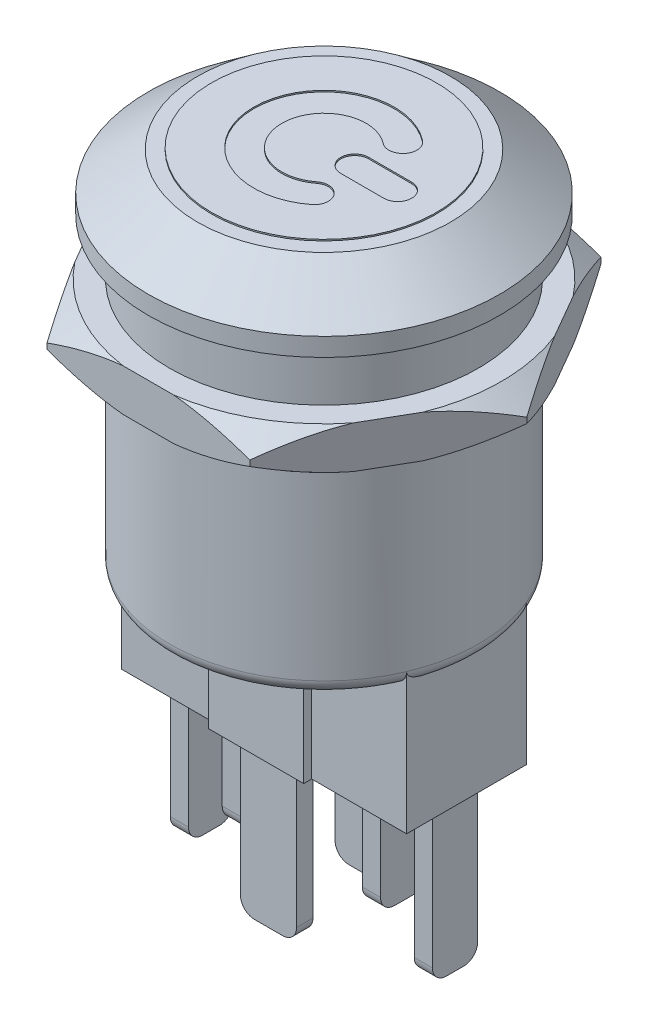
from build123d import *

# Parameters (mm, degrees)
SKETCH_1_R          = 11
EXTRUDE_1_DEPTH     = 15
EXTRUDE_5_DEPTH     = 9
EXTRUDE_START       = 9
SKETCH_2_W          = 1.293526219
SKETCH_2_H          = 3.220572058
SKETCH_2_W_2        = 1.29352622
SKETCH_2_W_3        = 3.99471459
SKETCH_2_H_2        = 1.168280376
EXTRUDE_2_DEPTH     = 11
EXTRUDE_6_DEPTH     = 3
SKETCH_10_R         = 12.5
EXTRUDE_7_DEPTH     = 8
CHAMFER_2_SIZE      = 2.7
CHAMFER_2_SIZE2     = 3.5
FILLET_2_R          = 1
FILLET_3_R          = 1
SKETCH_13_R         = 8
EXTRUDE_8_DEPTH     = 0.1
CUT_EXTRUDE_3_DEPTH = 0.1
FILLET_4_R          = 1
FILLET_5_R          = 1
SKETCH_15_R         = 12.5
SKETCH_15_R_2       = 11
CUT_EXTRUDE_4_DEPTH = 4
CUT_EXTRUDE_5_DEPTH = 0.1
SKETCH_17_W         = 1.293526219
SKETCH_17_H         = 2.5
CUT_EXTRUDE_6_DEPTH = 33.994598121
FILLET_6_R          = 1


# Some blends are built 0.0001 mm under size
with BuildPart() as part:
    # 草图1 → 凸台-拉伸1 (new body)
    with BuildSketch(Plane(origin=(0, 0, 0), x_dir=(1, 0, 0), z_dir=(0, 1, 0))):
        with Locations(Location((0, 0, 0), (0, 0, 270))):
            Circle(SKETCH_1_R)
    extrude(amount=EXTRUDE_1_DEPTH)

    # 草图8 → 凸台-拉伸5 (add)
    with BuildSketch(Plane.XZ):
        Polygon((-3.382547232, 4.259557328), (-3.382547232, 4.825560501), (3.382547232, 4.825560501), (3.382547232, 4.259557328), (10.141803162, 4.259557328), (10.141803162, -4.259557328), (3.382547232, -4.259557328), (3.382547232, -4.825560501), (-3.382547232, -4.825560501), (-3.382547232, -4.259557328), (-10.141803162, -4.259557328), (-10.141803162, 4.259557328), align=None)
    extrude(amount=EXTRUDE_5_DEPTH)

    # 草图2 → 凸台-拉伸2 (add)
    with BuildSketch(Plane.XZ.offset(EXTRUDE_START)):
        with Locations((-4.988450059, 0)):
            Rectangle(SKETCH_2_W, SKETCH_2_H)
        with Locations((4.988450059, 0)):
            Rectangle(SKETCH_2_W, SKETCH_2_H)
        with Locations((8.683189087, 0)):
            Rectangle(SKETCH_2_W_2, SKETCH_2_H)
        with Locations((-8.683189087, 0)):
            Rectangle(SKETCH_2_W_2, SKETCH_2_H)
        with Locations((0, -3.368236223)):
            Rectangle(SKETCH_2_W_3, SKETCH_2_H_2)
        with Locations((0, 3.368236223)):
            Rectangle(SKETCH_2_W_3, SKETCH_2_H_2)
    extrude(amount=EXTRUDE_2_DEPTH)

    # 草图9 → 凸台-拉伸6 (add)
    with BuildSketch(Plane(origin=(0, 15, 0), x_dir=(1, 0, 0), z_dir=(0, 1, 0))):
        Polygon((-7.216878365, 12.5), (-14.43375673, 0), (-7.216878365, -12.5), (7.216878365, -12.5), (14.43375673, 0), (7.216878365, 12.5), align=None)
    extrude(amount=EXTRUDE_6_DEPTH)

    # 草图10 → 凸台-拉伸7 (add)
    with BuildSketch(Plane(origin=(0, 18, 0), x_dir=(1, 0, 0), z_dir=(0, 1, 0))):
        with Locations(Location((0, 0, 0), (0, 0, 270))):
            Circle(SKETCH_10_R)
    extrude(amount=EXTRUDE_7_DEPTH)

    # 倒角2
    chamfer_2_edges = [part.edges().sort_by_distance(p)[0] for p in [
        (0, 26, -12.5),
    ]]
    chamfer_2_side = [part.faces().sort_by_distance(p)[0] for p in [
        (0, 22, -12.5),
    ]]
    chamfer(chamfer_2_edges, length=CHAMFER_2_SIZE, length2=CHAMFER_2_SIZE2, reference=chamfer_2_side[0])

    # 草图12 → 切除-旋转1 (revolve, cut)
    with BuildSketch(Plane.XY, mode=Mode.PRIVATE) as cut_revolve_1_sk:
        Polygon((-12.629537139, 18), (-14.43375673, 16.7), (-14.43375673, 16.3), (-12.629537139, 15), (-12.629537139, 14.5), (-14.93375673, 14.5), (-14.93375673, 18.5), (-12.629537139, 18.5), align=None)
    revolve(cut_revolve_1_sk.sketch.rotate(Axis((0, 15, 0), (0, 1, 0)), 202.78240573), axis=Axis((0, 15, 0), (0, 1, 0)), mode=Mode.SUBTRACT)

    # 圆角2
    # the kernel refuses this fillet: 1 mm, written as the material it takes off along each edge
    with BuildSketch(Plane(origin=(0, 0, 0), x_dir=(0.9219821056073602, 0, -0.3872324843550948), z_dir=(0.3872324843550948, 0, 0.9219821056073602))) as fillet_2_piece_1_section:
        with BuildLine():
            CenterArc((11 - FILLET_2_R, FILLET_2_R), FILLET_2_R, 270, 90)
            Line((11 - FILLET_2_R, 0), (11, 0))
            Line((11, 0), (11, FILLET_2_R))
        make_face()
    fillet_2_piece_1 = revolve(axis=Axis((0, 0, 0), (0, 1, 0)), revolution_arc=134.435188539, mode=Mode.PRIVATE)
    fillet_2_piece_1 = split(fillet_2_piece_1, bisect_by=Plane(origin=(0, 0.280498427, -4.259557328), z_dir=(0, 0, -1)), keep=Keep.TOP, mode=Mode.PRIVATE)
    add(fillet_2_piece_1, mode=Mode.SUBTRACT)
    with BuildSketch(Plane(origin=(0, 0, 0), x_dir=(0, 0, 1), z_dir=(-1, 0, 0))) as fillet_2_piece_2_section:
        with BuildLine():
            CenterArc((11 - FILLET_2_R, FILLET_2_R), FILLET_2_R, 270, 90)
            Line((11 - FILLET_2_R, 0), (11, 0))
            Line((11, 0), (11, FILLET_2_R))
        make_face()
    fillet_2_piece_2 = revolve(axis=Axis((0, 0, 0), (0, 1, 0)), revolution_arc=67.21759427, mode=Mode.PRIVATE)
    fillet_2_piece_2 = split(fillet_2_piece_2, bisect_by=Plane(origin=(5.932037011, 0.283055472, 4.259557328), z_dir=(0, 0, 1)), keep=Keep.TOP, mode=Mode.PRIVATE)
    add(fillet_2_piece_2, mode=Mode.SUBTRACT)
    with BuildSketch(Plane(origin=(0, 0, 0), x_dir=(-0.9219821056073602, 0, 0.38723248435509466), z_dir=(-0.38723248435509466, 0, -0.9219821056073602))) as fillet_2_piece_3_section:
        with BuildLine():
            CenterArc((11 - FILLET_2_R, FILLET_2_R), FILLET_2_R, 270, 90)
            Line((11 - FILLET_2_R, 0), (11, 0))
            Line((11, 0), (11, FILLET_2_R))
        make_face()
    fillet_2_piece_3 = revolve(axis=Axis((0, 0, 0), (0, 1, 0)), revolution_arc=67.21759427, mode=Mode.PRIVATE)
    fillet_2_piece_3 = split(fillet_2_piece_3, bisect_by=Plane(origin=(-5.93203701, 0.283055475, 4.259557328), z_dir=(0, 0, 1)), keep=Keep.TOP, mode=Mode.PRIVATE)
    add(fillet_2_piece_3, mode=Mode.SUBTRACT)

    # 圆角3
    # the kernel refuses this fillet: 1 mm, written as the material it takes off along each edge
    with BuildSketch(Plane(origin=(0, 0, 0), x_dir=(0.811007517406604, 0, 0.5850357311395405), z_dir=(-0.5850357311395405, 0, 0.811007517406604))) as fillet_3_piece_1_section:
        with BuildLine():
            CenterArc((11 - FILLET_3_R, FILLET_3_R), FILLET_3_R, 270, 90)
            Line((11 - FILLET_3_R, 0), (11, 0))
            Line((11, 0), (11, FILLET_3_R))
        make_face()
    fillet_3_piece_1 = revolve(axis=Axis((0, 0, 0), (0, 1, 0)), revolution_arc=71.611028585, mode=Mode.PRIVATE)
    fillet_3_piece_1 = split(fillet_3_piece_1, bisect_by=Plane(origin=(9.365381882, 0.233729185, 4.259557328), z_dir=(0, 0, 1)), keep=Keep.TOP, mode=Mode.PRIVATE)
    fillet_3_piece_1 = split(fillet_3_piece_1, bisect_by=Plane(origin=(10.141803162, 0.233729185, 5.307217675), z_dir=(-1, 0, 0)), keep=Keep.TOP, mode=Mode.PRIVATE)
    add(fillet_3_piece_1, mode=Mode.SUBTRACT)
    with BuildSketch(Plane(origin=(0, 0, 0), x_dir=(0.811007517406604, 0, 0.5850357311395405), z_dir=(-0.5850357311395405, 0, 0.811007517406604))) as fillet_3_piece_2_section:
        with BuildLine():
            CenterArc((11 - FILLET_3_R, FILLET_3_R), FILLET_3_R, 270, 90)
            Line((11 - FILLET_3_R, 0), (11, 0))
            Line((11, 0), (11, FILLET_3_R))
        make_face()
    fillet_3_piece_2 = revolve(axis=Axis((0, 0, 0), (0, 1, 0)), revolution_arc=71.611028585, mode=Mode.PRIVATE)
    fillet_3_piece_2 = split(fillet_3_piece_2, bisect_by=Plane(origin=(9.365382131, 0.233729175, -4.259557328), z_dir=(0, 0, -1)), keep=Keep.TOP, mode=Mode.PRIVATE)
    fillet_3_piece_2 = split(fillet_3_piece_2, bisect_by=Plane(origin=(10.141803162, 0.233729175, -5.307217523), z_dir=(-1, 0, 0)), keep=Keep.TOP, mode=Mode.PRIVATE)
    add(fillet_3_piece_2, mode=Mode.SUBTRACT)
    with BuildSketch(Plane(origin=(0, 0, 0), x_dir=(0.811007517406604, 0, 0.5850357311395405), z_dir=(-0.5850357311395405, 0, 0.811007517406604))) as fillet_3_piece_3_section:
        with BuildLine():
            CenterArc((11 - FILLET_3_R, FILLET_3_R), FILLET_3_R, 270, 90)
            Line((11 - FILLET_3_R, 0), (11, 0))
            Line((11, 0), (11, FILLET_3_R))
        make_face()
    fillet_3_piece_3 = revolve(axis=Axis((0, 0, 0), (0, 1, 0)), revolution_arc=71.611028585, mode=Mode.PRIVATE)
    fillet_3_piece_3 = split(fillet_3_piece_3, bisect_by=Plane(origin=(10.764842796, 0.336885819, 4.259557328), z_dir=(0, 0, -1)), keep=Keep.TOP, mode=Mode.PRIVATE)
    fillet_3_piece_3 = split(fillet_3_piece_3, bisect_by=Plane(origin=(10.764842796, 0.336885819, -4.259557328), z_dir=(0, 0, 1)), keep=Keep.TOP, mode=Mode.PRIVATE)
    fillet_3_piece_3 = split(fillet_3_piece_3, bisect_by=Plane(origin=(10.141803162, 0.336885819, 0), z_dir=(1, 0, 0)), keep=Keep.TOP, mode=Mode.PRIVATE)
    add(fillet_3_piece_3, mode=Mode.SUBTRACT)
    with BuildSketch(Plane(origin=(0, 0, 0), x_dir=(-0.8110075174066043, 0, -0.5850357311395403), z_dir=(0.5850357311395403, 0, -0.8110075174066043))) as fillet_3_piece_4_section:
        with BuildLine():
            CenterArc((11 - FILLET_3_R, FILLET_3_R), FILLET_3_R, 270, 90)
            Line((11 - FILLET_3_R, 0), (11, 0))
            Line((11, 0), (11, FILLET_3_R))
        make_face()
    fillet_3_piece_4 = revolve(axis=Axis((0, 0, 0), (0, 1, 0)), revolution_arc=71.611028585, mode=Mode.PRIVATE)
    fillet_3_piece_4 = split(fillet_3_piece_4, bisect_by=Plane(origin=(-9.365381882, 0.233729185, -4.259557328), z_dir=(0, 0, -1)), keep=Keep.TOP, mode=Mode.PRIVATE)
    fillet_3_piece_4 = split(fillet_3_piece_4, bisect_by=Plane(origin=(-10.141803162, 0.233729185, -5.307217675), z_dir=(1, 0, 0)), keep=Keep.TOP, mode=Mode.PRIVATE)
    add(fillet_3_piece_4, mode=Mode.SUBTRACT)
    with BuildSketch(Plane(origin=(0, 0, 0), x_dir=(-0.8110075174066043, 0, -0.5850357311395403), z_dir=(0.5850357311395403, 0, -0.8110075174066043))) as fillet_3_piece_5_section:
        with BuildLine():
            CenterArc((11 - FILLET_3_R, FILLET_3_R), FILLET_3_R, 270, 90)
            Line((11 - FILLET_3_R, 0), (11, 0))
            Line((11, 0), (11, FILLET_3_R))
        make_face()
    fillet_3_piece_5 = revolve(axis=Axis((0, 0, 0), (0, 1, 0)), revolution_arc=71.611028585, mode=Mode.PRIVATE)
    fillet_3_piece_5 = split(fillet_3_piece_5, bisect_by=Plane(origin=(-9.365382131, 0.233729175, 4.259557328), z_dir=(0, 0, 1)), keep=Keep.TOP, mode=Mode.PRIVATE)
    fillet_3_piece_5 = split(fillet_3_piece_5, bisect_by=Plane(origin=(-10.141803162, 0.233729175, 5.307217523), z_dir=(1, 0, 0)), keep=Keep.TOP, mode=Mode.PRIVATE)
    add(fillet_3_piece_5, mode=Mode.SUBTRACT)
    with BuildSketch(Plane(origin=(0, 0, 0), x_dir=(-0.8110075174066043, 0, -0.5850357311395403), z_dir=(0.5850357311395403, 0, -0.8110075174066043))) as fillet_3_piece_6_section:
        with BuildLine():
            CenterArc((11 - FILLET_3_R, FILLET_3_R), FILLET_3_R, 270, 90)
            Line((11 - FILLET_3_R, 0), (11, 0))
            Line((11, 0), (11, FILLET_3_R))
        make_face()
    fillet_3_piece_6 = revolve(axis=Axis((0, 0, 0), (0, 1, 0)), revolution_arc=71.611028585, mode=Mode.PRIVATE)
    fillet_3_piece_6 = split(fillet_3_piece_6, bisect_by=Plane(origin=(-10.764842796, 0.336885819, 4.259557328), z_dir=(0, 0, -1)), keep=Keep.TOP, mode=Mode.PRIVATE)
    fillet_3_piece_6 = split(fillet_3_piece_6, bisect_by=Plane(origin=(-10.764842796, 0.336885819, -4.259557328), z_dir=(0, 0, 1)), keep=Keep.TOP, mode=Mode.PRIVATE)
    fillet_3_piece_6 = split(fillet_3_piece_6, bisect_by=Plane(origin=(-10.141803162, 0.336885819, 0), z_dir=(-1, 0, 0)), keep=Keep.TOP, mode=Mode.PRIVATE)
    add(fillet_3_piece_6, mode=Mode.SUBTRACT)

    # 草图13 → 凸台-拉伸8 (add)
    with BuildSketch(Plane(origin=(0, 26, 0), x_dir=(1, 0, 0), z_dir=(0, 1, 0))):
        with Locations(Location((0, 0, 0), (0, 0, 270))):
            Circle(SKETCH_13_R)
    extrude(amount=EXTRUDE_8_DEPTH)

    # 草图14 → 切除-拉伸3 (cut)
    with BuildSketch(Plane(origin=(0, 26.1, 0), x_dir=(1, 0, 0), z_dir=(0, 1, 0))):
        with BuildLine():
            Line((5.250174633, -0.993620884), (2.189878709, -0.993620884))
            ThreePointArc((2.189878709, -0.993620884), (1.196257825, 0), (2.189878709, 0.993620884))
            Line((2.189878709, 0.993620884), (5.250174633, 0.993620884))
            ThreePointArc((5.250174633, 0.993620884), (6.243795517, 0), (5.250174633, -0.993620884))
        make_face()
        with BuildLine():
            Line((2.380060021, 1.826284287), (3.966766701, 3.043807145))
            ThreePointArc((3.966766701, 3.043807145), (-5, 0), (3.966766701, -3.043807145))
            Line((3.966766701, -3.043807145), (2.380060021, -1.826284287))
            ThreePointArc((2.380060021, -1.826284287), (-3, 0), (2.380060021, 1.826284287))
        make_face()
    extrude(amount=-CUT_EXTRUDE_3_DEPTH, mode=Mode.SUBTRACT)

    # 圆角4
    fillet_4_edges = [part.edges().sort_by_distance(p)[0] for p in [
        (2.380060021, 26.05, 1.826284287),
        (3.966766701, 26.05, 3.043807145),
        (2.380060021, 26.05, -1.826284287),
        (3.966766701, 26.05, -3.043807145),
    ]]
    fillet(fillet_4_edges, radius=FILLET_4_R - 0.0001)  # a hair under: the kernel refuses the full size

    # 圆角5
    fillet_5_edges = [part.edges().sort_by_distance(p)[0] for p in [
        (4.98845006, -20, 1.610286029),
        (4.98845006, -20, -1.610286029),
        (-4.98845006, -20, 1.610286029),
        (-4.98845006, -20, -1.610286029),
        (8.683189087, -20, 1.610286029),
        (8.683189087, -20, -1.610286029),
        (-8.683189087, -20, 1.610286029),
        (-8.683189087, -20, -1.610286029),
        (-1.997357295, -20, 3.368236223),
        (1.997357295, -20, 3.368236223),
        (-1.997357295, -20, -3.368236223),
        (1.997357295, -20, -3.368236223),
    ]]
    fillet(fillet_5_edges, radius=FILLET_5_R)

    # 草图15 → 切除-拉伸4 (cut)
    with BuildSketch(Plane(origin=(0, 18, 0), x_dir=(1, 0, 0), z_dir=(0, 1, 0))):
        with Locations(Location((0, 0, 0), (0, 0, 270))):
            Circle(SKETCH_15_R)
        with Locations(Location((0, 0, 0), (0, 0, 22.78240573))):
            Circle(SKETCH_15_R_2, mode=Mode.SUBTRACT)
    extrude(amount=CUT_EXTRUDE_4_DEPTH, mode=Mode.SUBTRACT)

    # 草图16 → 切除-拉伸5 (cut)
    # profile 1 of 3: a face of its own
    with BuildSketch(Plane(origin=(0, 0, -3.952376411), x_dir=(-1, 0, 0), z_dir=(0, 0, -1))):
        with BuildLine():
            Line((-1.632410444, -17.014702749), (-1.672683191, -16.979650543))
            Line((-1.672683191, -16.979650543), (-1.395994506, -16.758150437))
            add(Edge.make_bspline(
                [(-1.395994506, -16.758150437), (-1.384032445, -16.764552216), (-1.360405032, -16.777196984), (-1.324004489, -16.798095315), (-1.278445788, -16.814478473), (-1.221142501, -16.825076067), (-1.152810777, -16.832568507), (-1.103916702, -16.833163503), (-1.078287282, -16.833475389)],
                knots=[0, 0, 0, 0, 0.736410598, 1.454555069, 2.274010016, 3.348139226, 4.609940921, 6, 6, 6, 6], degree=3))
            Line((-1.078287282, -16.833475389), (1.48872742, -16.833475389))
            add(Edge.make_bspline(
                [(1.48872742, -16.833475389), (1.488900935, -16.812839266), (1.489218757, -16.775040607), (1.487301133, -16.724338256), (1.486186924, -16.684780124), (1.483774141, -16.652414865), (1.478864906, -16.617990797), (1.474454223, -16.573082278), (1.465458181, -16.513548394), (1.455817348, -16.443938946), (1.446382649, -16.373222272), (1.436692776, -16.31160858), (1.42838672, -16.263612324), (1.420351829, -16.218687015), (1.406228234, -16.173788752), (1.376704155, -16.135579285), (1.348040589, -16.110346225), (1.340700151, -16.090901979), (1.338077516, -16.083954826)],
                knots=[0, 0, 0, 0, 1.27150406, 2.328981501, 3.126175441, 3.710121142, 4.327662917, 5.268274525, 6.49017685, 8.03704954, 9.599095043, 10.886100789, 11.880913806, 12.598963807, 13.703656117, 14.733133062, 15.547366409, 16, 16, 16, 16], degree=3))
            add(Edge.make_bspline(
                [(1.338077516, -16.083954826), (1.340835635, -16.08074225), (1.348551492, -16.071755042), (1.36360783, -16.051917319), (1.389953093, -16.021298701), (1.426406057, -15.983125506), (1.462510373, -15.944270639), (1.491113826, -15.913275367), (1.511539107, -15.891070277), (1.532889947, -15.882271214), (1.550028312, -15.878982209), (1.560068688, -15.87782836), (1.564052372, -15.877370552)],
                knots=[0, 0, 0, 0, 0.405362904, 1.134005909, 2.383645024, 4.270006098, 6.190009657, 7.453402544, 8.329302161, 9.032620798, 9.616176397, 10, 10, 10, 10], degree=3))
            add(Edge.make_bspline(
                [(1.564052372, -15.877370552), (1.568833653, -15.879456074), (1.578446692, -15.883649136), (1.588003755, -15.898318223), (1.591766002, -15.917678469), (1.591597985, -15.950721012), (1.591240749, -15.998359781), (1.598828606, -16.060325874), (1.610143189, -16.126333111), (1.61685103, -16.179186482), (1.622766247, -16.219126241), (1.625357825, -16.248289772), (1.629237441, -16.285063524), (1.63382012, -16.329531353), (1.638017965, -16.381784621), (1.643334528, -16.441687794), (1.649439042, -16.509274062), (1.653109038, -16.557030396), (1.655038948, -16.582143618)],
                knots=[0, 0, 0, 0, 0.341458338, 0.686521615, 1.112861068, 1.643765959, 2.887577717, 4.288495481, 5.798885704, 7.356069376, 7.841520158, 8.491637465, 9.308408245, 10.308331643, 11.473375756, 12.805059145, 14.319903331, 16, 16, 16, 16], degree=3))
            Line((1.655038948, -16.582143618), (1.675175322, -16.793202642))
            Line((1.675175322, -16.793202642), (1.684870612, -16.909546133))
            add(Edge.make_bspline(
                [(1.684870612, -16.909546133), (1.689308032, -16.921681109), (1.69650833, -16.941371706), (1.69091194, -16.970120056), (1.674236221, -16.98303427), (1.655570308, -16.992254058), (1.626853375, -16.991882494), (1.587250144, -16.986466051), (1.53258125, -16.979371996), (1.491473455, -16.976197221), (1.468591047, -16.974430002)],
                knots=[0, 0, 0, 0, 1.061890483, 1.723057128, 2.249565985, 2.748629047, 3.431374921, 4.573939267, 6.092903808, 8, 8, 8, 8], degree=3))
            Line((1.468591047, -16.974430002), (1.171765989, -16.964734711))
            Line((1.171765989, -16.964734711), (-1.093948906, -16.964734711))
            add(Edge.make_bspline(
                [(-1.093948906, -16.964734711), (-1.122041433, -16.964628518), (-1.172509919, -16.964437741), (-1.239623462, -16.965551577), (-1.289616628, -16.965734301), (-1.334107535, -16.967984922), (-1.381109556, -16.970750903), (-1.439458023, -16.974800971), (-1.507739942, -16.984162494), (-1.555491999, -16.997621589), (-1.581696615, -17.005007458)],
                knots=[0, 0, 0, 0, 1.372320021, 2.465385735, 3.279152833, 3.814059266, 4.641307686, 5.579263069, 6.671586417, 8, 8, 8, 8], degree=3))
            Line((-1.581696615, -17.005007458), (-1.632410444, -17.014702749))
        make_face()
    # profile 2 of 3: a face of its own
    with BuildSketch(Plane(origin=(0, 0, -3.952376411), x_dir=(-1, 0, 0), z_dir=(0, 0, -1))):
        with BuildLine():
            Line((-1.18418969, -15.238227147), (-0.076689157, -15.238227147))
            Line((-0.076689157, -15.238227147), (-0.131877736, -14.815363307))
            add(Edge.make_bspline(
                [(-0.131877736, -14.815363307), (-0.133935728, -14.800168087), (-0.138513794, -14.766365863), (-0.149763204, -14.714562621), (-0.161304929, -14.662446521), (-0.173965498, -14.615791537), (-0.188267858, -14.57576116), (-0.201850674, -14.539243233), (-0.217695514, -14.506297429), (-0.231304685, -14.487303238), (-0.237780144, -14.478265502)],
                knots=[0, 0, 0, 0, 1.03230253, 2.296388048, 3.56754914, 4.627713308, 5.548966214, 6.428824589, 7.25240995, 8, 8, 8, 8], degree=3))
            Line((-0.237780144, -14.478265502), (-0.263137059, -14.432772214))
            Line((-0.263137059, -14.432772214), (-0.116961904, -14.286597059))
            add(Edge.make_bspline(
                [(-0.116961904, -14.286597059), (-0.108484317, -14.279849925), (-0.09439591, -14.268637257), (-0.070930664, -14.262452777), (-0.052980796, -14.267518085), (-0.041017065, -14.278807053), (-0.031657928, -14.293634709), (-0.031356758, -14.305575232), (-0.03119587, -14.311953974)],
                knots=[0, 0, 0, 0, 1.601115835, 2.660800761, 3.469019695, 4.255773855, 5.068217693, 6, 6, 6, 6], degree=3))
            Line((-0.03119587, -14.311953974), (0.099317661, -15.238227147))
            Line((0.099317661, -15.238227147), (1.463370506, -15.238227147))
            Line((1.463370506, -15.238227147), (1.35821389, -14.487960793))
            add(Edge.make_bspline(
                [(1.35821389, -14.487960793), (1.35629947, -14.476197215), (1.352411358, -14.452305838), (1.340414214, -14.417449536), (1.326580742, -14.381663594), (1.313997351, -14.358807607), (1.307500061, -14.347006179)],
                knots=[0, 0, 0, 0, 0.947579716, 1.924498142, 2.928338324, 4, 4, 4, 4], degree=3))
            Line((1.307500061, -14.347006179), (1.282143146, -14.302258683))
            Line((1.282143146, -14.302258683), (1.438759383, -14.16130407))
            add(Edge.make_bspline(
                [(1.438759383, -14.16130407), (1.447120547, -14.154152474), (1.460731502, -14.142510548), (1.484767398, -14.13959398), (1.500382336, -14.145127043), (1.51247619, -14.153463349), (1.519101858, -14.169923524), (1.519225789, -14.182872323), (1.519304876, -14.191135734)],
                knots=[0, 0, 0, 0, 1.61347962, 2.626547958, 3.452031848, 4.063658923, 4.764303741, 6, 6, 6, 6], degree=3))
            Line((1.519304876, -14.191135734), (1.523779626, -14.266460686))
            add(Edge.make_bspline(
                [(1.523779626, -14.266460686), (1.525695339, -14.287598618), (1.529823848, -14.333152482), (1.538044314, -14.405755506), (1.548888568, -14.487463309), (1.560421704, -14.578041367), (1.574908056, -14.677689593), (1.591099813, -14.78611362), (1.610140474, -14.903600057), (1.622997933, -14.984902234), (1.629682034, -15.027168123)],
                knots=[0, 0, 0, 0, 0.663087027, 1.429003413, 2.282528104, 3.23817949, 4.281637937, 5.428377517, 6.663111914, 8, 8, 8, 8], degree=3))
            Line((1.629682034, -15.027168123), (1.66995478, -15.25836352))
            add(Edge.make_bspline(
                [(1.66995478, -15.25836352), (1.677129517, -15.276361999), (1.68987339, -15.308331159), (1.700967688, -15.3526012), (1.700903982, -15.390713708), (1.681118991, -15.420600897), (1.643564378, -15.435638089), (1.615838331, -15.431995851), (1.59985037, -15.429895589)],
                knots=[0, 0, 0, 0, 1.383058101, 2.456607969, 3.258011524, 4.026838676, 4.862195312, 6, 6, 6, 6], degree=3))
            add(Edge.make_bspline(
                [(1.59985037, -15.429895589), (1.594099424, -15.429038511), (1.577517767, -15.426567305), (1.549098167, -15.415931186), (1.511944273, -15.405449476), (1.467457993, -15.395667345), (1.410539351, -15.389229318), (1.367673279, -15.386185869), (1.342552266, -15.384402301)],
                knots=[0, 0, 0, 0, 0.398397426, 1.148696135, 2.072283446, 3.049644871, 4.270989029, 6, 6, 6, 6], degree=3))
            Line((1.342552266, -15.384402301), (1.247090941, -15.384402301))
            add(Edge.make_bspline(
                [(1.247090941, -15.384402301), (1.233172811, -15.383579597), (1.207579563, -15.382066772), (1.172744482, -15.381070914), (1.144691298, -15.378863742), (1.128264217, -15.379084736), (1.121052159, -15.37918176)],
                knots=[0, 0, 0, 0, 1.325956836, 2.438225671, 3.314326982, 4, 4, 4, 4], degree=3))
            Line((1.121052159, -15.37918176), (-1.18418969, -15.384402301))
            add(Edge.make_bspline(
                [(-1.18418969, -15.384402301), (-1.195892743, -15.394322483), (-1.219566172, -15.414389447), (-1.253416523, -15.443788468), (-1.284737714, -15.469123811), (-1.310792908, -15.489652), (-1.334459266, -15.502741115), (-1.357261689, -15.509452778), (-1.377147626, -15.50799104), (-1.396973047, -15.511634443), (-1.410169305, -15.490783697), (-1.407465988, -15.475192112), (-1.405689797, -15.464947795)],
                knots=[0, 0, 0, 0, 1.533812955, 3.102661713, 4.480565352, 5.56413785, 6.409116688, 7.180740164, 7.877048739, 8.449192083, 8.981054931, 10, 10, 10, 10], degree=3))
            Line((-1.405689797, -15.464947795), (-1.390773965, -15.369486469))
            add(Edge.make_bspline(
                [(-1.390773965, -15.369486469), (-1.387875656, -15.348369012), (-1.382803648, -15.311413703), (-1.378117779, -15.262715072), (-1.376179104, -15.226418015), (-1.379101475, -15.206392576), (-1.380332882, -15.1979544)],
                knots=[0, 0, 0, 0, 1.482629705, 2.594585164, 3.407796403, 4, 4, 4, 4], degree=3))
            Line((-1.380332882, -15.1979544), (-1.380332882, -15.183038568))
            add(Edge.make_bspline(
                [(-1.380332882, -15.183038568), (-1.380453485, -15.163891758), (-1.38068069, -15.127821055), (-1.382953369, -15.076336169), (-1.386586265, -15.029784475), (-1.392951204, -15.000768798), (-1.395994506, -14.986895376)],
                knots=[0, 0, 0, 0, 1.164857084, 2.194475849, 3.136715034, 4, 4, 4, 4], degree=3))
            Line((-1.395994506, -14.986895376), (-1.431046711, -14.790006392))
            add(Edge.make_bspline(
                [(-1.431046711, -14.790006392), (-1.433774248, -14.770569597), (-1.438616559, -14.736062627), (-1.448792788, -14.688303476), (-1.457696771, -14.643651892), (-1.471586033, -14.598770066), (-1.484690485, -14.5532018), (-1.501121997, -14.513129539), (-1.51465919, -14.479373977), (-1.526518412, -14.460986736), (-1.531728578, -14.452908587)],
                knots=[0, 0, 0, 0, 1.329855264, 2.360948634, 3.30956627, 4.413671631, 5.543580002, 6.519930484, 7.349754398, 8, 8, 8, 8], degree=3))
            Line((-1.531728578, -14.452908587), (-1.561560242, -14.407415299))
            Line((-1.561560242, -14.407415299), (-1.410910338, -14.261985937))
            add(Edge.make_bspline(
                [(-1.410910338, -14.261985937), (-1.402196228, -14.25669026), (-1.387988734, -14.248056182), (-1.367486933, -14.240341633), (-1.350961856, -14.243802467), (-1.340000598, -14.254552318), (-1.330950441, -14.268787727), (-1.330566239, -14.280472187), (-1.330364845, -14.286597059)],
                knots=[0, 0, 0, 0, 1.630196536, 2.657874372, 3.387779644, 4.173512933, 5.042574534, 6, 6, 6, 6], degree=3))
            Line((-1.330364845, -14.286597059), (-1.319923762, -14.367142553))
            add(Edge.make_bspline(
                [(-1.319923762, -14.367142553), (-1.317842077, -14.384565255), (-1.313941685, -14.417209662), (-1.30616694, -14.462712544), (-1.302773088, -14.502224092), (-1.297391954, -14.534865593), (-1.295351327, -14.561391027), (-1.291244946, -14.581075562), (-1.291154573, -14.594883248), (-1.290372152, -14.60182103), (-1.290092098, -14.604304283)],
                knots=[0, 0, 0, 0, 1.761199297, 3.299907569, 4.630948369, 5.739111476, 6.618207111, 7.299334538, 7.749209594, 8, 8, 8, 8], degree=3))
            Line((-1.290092098, -14.604304283), (-1.18418969, -15.238227147))
        make_face()
    # profile 3 of 3: a face of its own
    with BuildSketch(Plane(origin=(0, 0, -3.952376411), x_dir=(-1, 0, 0), z_dir=(0, 0, -1))):
        with BuildLine():
            add(Edge.make_bspline(
                [(-1.174494399, -13.570637119), (-1.18034414, -13.583762895), (-1.190471377, -13.606486611), (-1.203882201, -13.627423536), (-1.209546605, -13.63626678)],
                knots=[0, 0, 0, 0, 1.155249011, 2, 2, 2, 2], degree=3))
            Line((-1.209546605, -13.63626678), (-1.284871557, -13.726507564))
            add(Edge.make_bspline(
                [(-1.284871557, -13.726507564), (-1.29136692, -13.735385042), (-1.303262573, -13.751643315), (-1.325825513, -13.767948303), (-1.34811973, -13.774671045), (-1.367940419, -13.77325854), (-1.384973401, -13.765585356), (-1.392316296, -13.756443716), (-1.395994506, -13.751864479)],
                knots=[0, 0, 0, 0, 1.448330946, 2.652483009, 3.610040529, 4.467515399, 5.232346567, 6, 6, 6, 6], degree=3))
            Line((-1.395994506, -13.751864479), (-1.380332882, -13.660877903))
            Line((-1.380332882, -13.660877903), (-1.380332882, -13.555721287))
            add(Edge.make_bspline(
                [(-1.380332882, -13.555721287), (-1.380573597, -13.553979845), (-1.381575521, -13.546731481), (-1.384746036, -13.530598343), (-1.390043811, -13.503815254), (-1.393808264, -13.482395168), (-1.395994506, -13.469955253)],
                knots=[0, 0, 0, 0, 0.241932977, 1.006992227, 2.261782692, 4, 4, 4, 4], degree=3))
            Line((-1.395994506, -13.469955253), (-1.405689797, -13.364052845))
            Line((-1.405689797, -13.364052845), (-1.460878375, -13.173130194))
            add(Edge.make_bspline(
                [(-1.460878375, -13.173130194), (-1.464823179, -13.157265137), (-1.473089214, -13.124021116), (-1.48160326, -13.070892753), (-1.488579137, -13.012941586), (-1.490475056, -12.972533534), (-1.491455831, -12.951630087)],
                knots=[0, 0, 0, 0, 0.875268756, 1.834059148, 2.879539399, 4, 4, 4, 4], degree=3))
            add(Edge.make_bspline(
                [(-1.491455831, -12.951630087), (-1.491224857, -12.930487653), (-1.49078407, -12.890139918), (-1.48595728, -12.832179418), (-1.479663646, -12.77930245), (-1.46717548, -12.715987644), (-1.440998299, -12.643710262), (-1.392659451, -12.566501611), (-1.328537503, -12.499216778), (-1.26333189, -12.45187689), (-1.203248733, -12.418586127), (-1.151915563, -12.394885858), (-1.094871245, -12.373157893), (-1.031940372, -12.354115118), (-0.963360914, -12.336047717), (-0.88888835, -12.320681241), (-0.8085533, -12.307105437), (-0.694693634, -12.292896804), (-0.55179473, -12.279034667), (-0.381500261, -12.27200631), (-0.21167238, -12.266210508), (-0.069206371, -12.261143597), (0.042859568, -12.255587007), (0.11969788, -12.253614864), (0.188060954, -12.251984509), (0.230824853, -12.251538977), (0.250713357, -12.251331771)],
                knots=[0, 0, 0, 0, 0.718538458, 1.37124224, 1.976068574, 2.527981319, 3.562640307, 4.568635326, 5.602880064, 6.703270975, 7.293454773, 7.936235116, 8.62368568, 9.366802049, 10.170319143, 11.033858136, 11.950826764, 12.939311179, 14.933992802, 16.829310187, 18.731999009, 20.711007917, 21.675354341, 22.546182103, 23.323862819, 24, 24, 24, 24], degree=3))
            add(Edge.make_bspline(
                [(0.250713357, -12.251331771), (0.272838839, -12.252316376), (0.319830368, -12.254407543), (0.394436414, -12.257938123), (0.476940223, -12.263502776), (0.596947549, -12.270956567), (0.749711633, -12.284779972), (0.900008905, -12.312673768), (1.016184747, -12.33915172), (1.098483033, -12.36696171), (1.1776678, -12.397508038), (1.251649527, -12.434493472), (1.32038048, -12.472853114), (1.380890446, -12.514530558), (1.434729201, -12.555555972), (1.478866103, -12.600266642), (1.516558571, -12.646320409), (1.546503258, -12.696076552), (1.570017376, -12.749115175), (1.585542323, -12.807923868), (1.597894387, -12.874630202), (1.610598136, -12.953214265), (1.623140602, -13.045733541), (1.630803075, -13.112208509), (1.634902575, -13.147773279)],
                knots=[0, 0, 0, 0, 0.774391767, 1.644703279, 2.611460416, 3.665519734, 5.84942217, 7.968782564, 9.006042328, 10.012093582, 11.003163315, 11.971131072, 12.901568016, 13.752610517, 14.538623168, 15.263892889, 15.944002951, 16.614828943, 17.288240449, 17.965232767, 18.735760987, 19.660332748, 20.748254692, 22, 22, 22, 22], degree=3))
            Line((1.634902575, -13.147773279), (1.660259489, -13.369273386))
            add(Edge.make_bspline(
                [(1.660259489, -13.369273386), (1.663881459, -13.390482014), (1.670494159, -13.429203011), (1.691353849, -13.471163883), (1.708485745, -13.496071437), (1.717598985, -13.509439908), (1.723144089, -13.518614292), (1.724682116, -13.523637428), (1.725143359, -13.525143831)],
                knots=[0, 0, 0, 0, 2.258427549, 4.123254342, 4.879658115, 5.446960944, 5.834147501, 6, 6, 6, 6], degree=3))
            add(Edge.make_bspline(
                [(1.725143359, -13.525143831), (1.725204632, -13.529440719), (1.725357638, -13.54017058), (1.714962025, -13.557497445), (1.699121112, -13.579089769), (1.677489334, -13.603768514), (1.654352704, -13.62786205), (1.634299871, -13.649085591), (1.618060614, -13.664700921), (1.608329, -13.673088587), (1.604325119, -13.676539527)],
                knots=[0, 0, 0, 0, 0.515041456, 1.286122216, 2.369019342, 3.805861189, 5.260733457, 6.437154143, 7.356997878, 8, 8, 8, 8], degree=3))
            Line((1.604325119, -13.676539527), (1.53944125, -13.736948647))
            add(Edge.make_bspline(
                [(1.53944125, -13.736948647), (1.530014387, -13.745758405), (1.515491696, -13.759330406), (1.491129463, -13.772779963), (1.47678226, -13.765473794), (1.464197089, -13.760073385), (1.460486142, -13.741902856), (1.462249889, -13.729296573), (1.463370506, -13.721287023)],
                knots=[0, 0, 0, 0, 1.909289278, 2.941383463, 3.587608449, 4.134775612, 4.814907781, 6, 6, 6, 6], degree=3))
            Line((1.463370506, -13.721287023), (1.463370506, -13.651182612))
            Line((1.463370506, -13.651182612), (1.463370506, -13.570637119))
            Line((1.463370506, -13.570637119), (-1.174494399, -13.570637119))
        make_face()
        with BuildLine():
            add(Edge.make_bspline(
                [(1.453675215, -13.429682506), (1.454522226, -13.413278223), (1.456100105, -13.382719039), (1.456828631, -13.340193859), (1.456473461, -13.304583001), (1.454533701, -13.28325241), (1.453675215, -13.273812061)],
                knots=[0, 0, 0, 0, 1.263219645, 2.353224488, 3.271181221, 4, 4, 4, 4], degree=3))
            Line((1.453675215, -13.273812061), (1.4283183, -13.052311954))
            add(Edge.make_bspline(
                [(1.4283183, -13.052311954), (1.425323222, -13.023450435), (1.419573533, -12.968044609), (1.407557604, -12.888855577), (1.38998301, -12.817705997), (1.369979559, -12.752830888), (1.34057824, -12.694078302), (1.298298734, -12.642670578), (1.244225876, -12.597187526), (1.179017364, -12.560289603), (1.109294668, -12.528042358), (1.039860372, -12.498225664), (0.970662394, -12.476294556), (0.879018235, -12.451776752), (0.758267254, -12.429087863), (0.602939932, -12.408269509), (0.431205858, -12.393921784), (0.241297726, -12.389229371), (0.031440678, -12.388656924), (-0.115223307, -12.391036207), (-0.192286856, -12.392286384)],
                knots=[0, 0, 0, 0, 0.79267612, 1.521710462, 2.185484311, 2.793222695, 3.373318457, 3.967241055, 4.598502874, 5.292638127, 6.006490913, 6.697596666, 7.354737148, 7.987276124, 9.288456357, 10.706975028, 12.267435263, 13.99317993, 15.894644864, 18, 18, 18, 18], degree=3))
            add(Edge.make_bspline(
                [(-0.192286856, -12.392286384), (-0.221126443, -12.39398989), (-0.280802551, -12.397514856), (-0.373498212, -12.403725086), (-0.472443325, -12.409669054), (-0.57492448, -12.415118609), (-0.675486248, -12.421887457), (-0.768576139, -12.432157677), (-0.851758343, -12.445390181), (-0.925538178, -12.461702641), (-0.99157138, -12.481395716), (-1.051617452, -12.503982107), (-1.105306213, -12.532185551), (-1.154373298, -12.562149346), (-1.196622622, -12.597331443), (-1.231196528, -12.637213855), (-1.258981884, -12.681413112), (-1.283339282, -12.743738237), (-1.304457924, -12.816957088), (-1.312050025, -12.874951932), (-1.315449013, -12.900916258)],
                knots=[0, 0, 0, 0, 1.134789727, 2.348155525, 3.649235455, 5.028301678, 6.379392189, 7.607637363, 8.705701021, 9.686478845, 10.573151737, 11.410944318, 12.201419402, 12.95185741, 13.665764929, 14.351049918, 15.017643395, 15.704943012, 16.972501634, 18, 18, 18, 18], degree=3))
            add(Edge.make_bspline(
                [(-1.315449013, -12.900916258), (-1.316018979, -12.91857299), (-1.31720832, -12.955416997), (-1.312464088, -13.013385003), (-1.30612997, -13.07637644), (-1.29601541, -13.141822104), (-1.283250272, -13.203730468), (-1.272842105, -13.257471818), (-1.26171633, -13.299786763), (-1.253414145, -13.323816468), (-1.249819351, -13.33422118)],
                knots=[0, 0, 0, 0, 0.962558941, 2.008555672, 3.167241635, 4.415334796, 5.616995679, 6.613970987, 7.399858102, 8, 8, 8, 8], degree=3))
            Line((-1.249819351, -13.33422118), (-1.209546605, -13.429682506))
            Line((-1.209546605, -13.429682506), (1.453675215, -13.429682506))
        make_face(mode=Mode.SUBTRACT)
    extrude(amount=-CUT_EXTRUDE_5_DEPTH, mode=Mode.SUBTRACT)

    # 草图17 → 切除-拉伸6 (cut, through all)
    with BuildSketch(Plane(origin=(0, 0, -1.610286029), x_dir=(-1, 0, 0), z_dir=(0, 0, -1))):
        with Locations((-4.988450059, -18.75)):
            Rectangle(SKETCH_17_W, SKETCH_17_H)
        with Locations((4.988450059, -18.75)):
            Rectangle(SKETCH_17_W, SKETCH_17_H)
    extrude(amount=-CUT_EXTRUDE_6_DEPTH, mode=Mode.SUBTRACT)

    # 圆角6
    fillet_6_edges = [part.edges().sort_by_distance(p)[0] for p in [
        (4.98845006, -17.5, 1.610286029),
        (4.98845006, -17.5, -1.610286029),
        (-4.98845006, -17.5, 1.610286029),
        (-4.98845006, -17.5, -1.610286029),
    ]]
    fillet(fillet_6_edges, radius=FILLET_6_R)


solid = part.part
